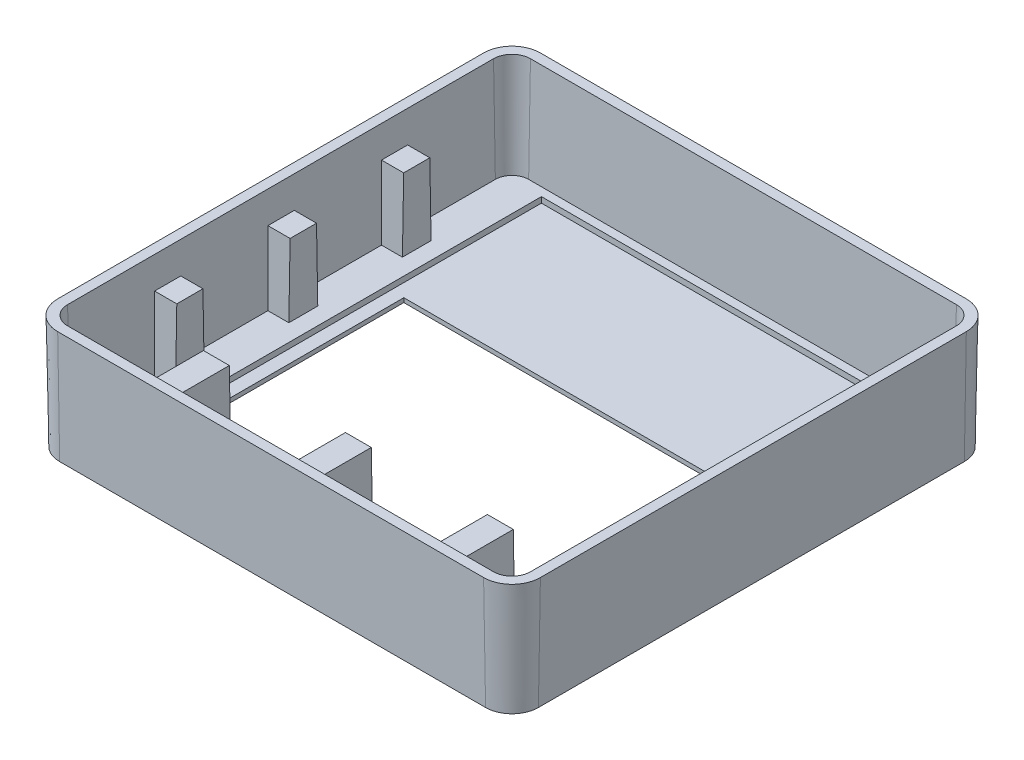
from build123d import *

# Parameters (mm, degrees)
BOSS_EXTRUDE1_DEPTH  = 4
BOSS_EXTRUDE1_DRAFT  = -1
SHELL1_T             = -0.35
SKETCH2_W            = 12.58
SKETCH2_H            = 6.98
CUT_EXTRUDE1_DEPTH   = 2
SKETCH3_W            = 13.5
SKETCH3_H            = 13.096235698
CUT_EXTRUDE2_DEPTH   = 0.2
BOSS_EXTRUDE3_REACH  = 20.425
BOSS_EXTRUDE4_REACH  = 20.425
LPATTERN2_COUNT      = 2
LPATTERN2_PITCH      = 4
MIRROR4_COPY_1_REACH = 20.425
MIRROR4_COPY_2_REACH = 20.425
LPATTERN3_COUNT      = 2
LPATTERN3_PITCH      = 4
MIRROR5_COPY_1_REACH = 20.425
MIRROR5_COPY_2_REACH = 20.425
BOSS_EXTRUDE5_REACH  = 18.785
LPATTERN4_COUNT      = 2
LPATTERN4_PITCH      = 5
MIRROR6_COPY_1_REACH = 18.785
MIRROR6_COPY_2_REACH = 18.785


with BuildPart() as part:
    # Sketch1 → Boss-Extrude1 (with draft: the straight prism first)
    with BuildSketch(Plane(origin=(0, 0, 0), x_dir=(1, 0, 0), z_dir=(0, 1, 0))):
        with BuildLine():
            Line((-7.5, -8.5), (7.5, -8.5))
            ThreePointArc((7.5, -8.5), (8.207106781, -8.207106781), (8.5, -7.5))
            Line((8.5, -7.5), (8.5, 7.5))
            ThreePointArc((8.5, 7.5), (8.207106781, 8.207106781), (7.5, 8.5))
            Line((7.5, 8.5), (-7.5, 8.5))
            ThreePointArc((-7.5, 8.5), (-8.207106781, 8.207106781), (-8.5, 7.5))
            Line((-8.5, 7.5), (-8.5, -7.5))
            ThreePointArc((-8.5, -7.5), (-8.207106781, -8.207106781), (-7.5, -8.5))
        make_face()
    extrude(amount=-BOSS_EXTRUDE1_DEPTH)
    # Boss-Extrude1: the draft: its side faces are tilted about the plane it starts from
    boss_extrude1_sides = [part.faces().sort_by_distance(p)[0] for p in [
        (0, -2, 8.5),
        (8.207106781, -2, 8.207106781),
        (8.5, -2, 0),
        (8.207106781, -2, -8.207106781),
        (0, -2, -8.5),
        (-8.207106781, -2, -8.207106781),
        (-8.5, -2, 0),
        (-8.207106781, -2, 8.207106781),
    ]]
    draft(boss_extrude1_sides, Plane(origin=(0, 0, 0), x_dir=(1, 0, 0), z_dir=(0, 1, 0)), BOSS_EXTRUDE1_DRAFT)

    # Shell1
    shell1_openings = [part.faces().sort_by_distance(p)[0] for p in [
        (0, 0, 0),
    ]]
    offset(amount=SHELL1_T, openings=shell1_openings, kind=Kind.INTERSECTION)

    # Sketch2 → Cut-Extrude1 (cut)
    with BuildSketch(Plane.XZ.offset(4)):
        with Locations((0, 1.01)):
            Rectangle(SKETCH2_W, SKETCH2_H)
    extrude(amount=-CUT_EXTRUDE1_DEPTH, mode=Mode.SUBTRACT)

    # Sketch3 → Cut-Extrude2 (cut)
    with BuildSketch(Plane(origin=(0, -3.65, 0), x_dir=(1, 0, 0), z_dir=(0, 1, 0))):
        with Locations((0, 1.238117849)):
            Rectangle(SKETCH3_W, SKETCH3_H)
    extrude(amount=-CUT_EXTRUDE2_DEPTH, mode=Mode.SUBTRACT)

    # Boss-Extrude3: up to this plane
    boss_extrude3_end = Plane(origin=(8.150053307, 0.006108342, 7.5), z_dir=(0.9998476951563913, -0.01745240643728355, 0))
    # Sketch11 → Boss-Extrude3 (add, up to the surface)
    with BuildSketch(Plane.ZY.offset(-7.35), mode=Mode.PRIVATE) as boss_extrude3_sk1:
        Polygon((-0.455489584, -1.1), (0.46508987, -1.1), (0.509600286, -3.65), (-0.5, -3.65), align=None)
    boss_extrude3_tool1 = split(extrude(boss_extrude3_sk1.sketch, amount=-BOSS_EXTRUDE3_REACH, mode=Mode.PRIVATE), bisect_by=boss_extrude3_end, keep=Keep.BOTH, mode=Mode.PRIVATE)
    boss_extrude3 = boss_extrude3_tool1.solids().sort_by_distance((7.35, -2.394601, 0.0048))[0]
    add(boss_extrude3)

    # Boss-Extrude4: up to this plane
    boss_extrude4_end = Plane(origin=(-8.150053307, 0.006108342, 7.5), z_dir=(-0.9998476951563913, -0.01745240643728355, 0))
    # Sketch13 → Boss-Extrude4 (add, up to the surface)
    with BuildSketch(Plane(origin=(-7.35, 0, 0), x_dir=(0, 0, -1), z_dir=(1, 0, 0)), mode=Mode.PRIVATE) as boss_extrude4_sk1:
        Polygon((-0.5, -3.65), (0.509600286, -3.65), (0.46508987, -1.1), (-0.455489584, -1.1), align=None)
    boss_extrude4_tool1 = split(extrude(boss_extrude4_sk1.sketch, amount=-BOSS_EXTRUDE4_REACH, mode=Mode.PRIVATE), bisect_by=boss_extrude4_end, keep=Keep.BOTH, mode=Mode.PRIVATE)
    boss_extrude4 = boss_extrude4_tool1.solids().sort_by_distance((-7.35, -2.394601, -0.0048))[0]
    add(boss_extrude4)

    # LPattern2: Boss-Extrude3 ×2
    with Locations(*[(0, 0, i * LPATTERN2_PITCH) for i in range(1, LPATTERN2_COUNT)]):
        add(boss_extrude3)

    # Mirror4 copy 1: up to this plane
    mirror4_copy_1_end = Plane(origin=(8.150053307, 0.006108342, 7.5), z_dir=(0.9998476951563913, -0.01745240643728355, 0))
    # Mirror4 copy 1 sketch → Mirror4 copy 1 (add, up to the surface)
    with BuildSketch(Plane(origin=(7.35, 0, -4), x_dir=(0, 0, -1), z_dir=(-1, 0, 0)), mode=Mode.PRIVATE) as mirror4_copy_1_sk1:
        Polygon((-0.455489584, 1.1), (0.46508987, 1.1), (0.509600286, 3.65), (-0.5, 3.65), align=None)
    mirror4_copy_1_tool1 = split(extrude(mirror4_copy_1_sk1.sketch, amount=-MIRROR4_COPY_1_REACH, mode=Mode.PRIVATE), bisect_by=mirror4_copy_1_end, keep=Keep.BOTH, mode=Mode.PRIVATE)
    add(mirror4_copy_1_tool1.solids().sort_by_distance((7.35, -2.394601, 0.0048))[0])

    # Mirror4 copy 2: up to this plane
    mirror4_copy_2_end = Plane(origin=(8.150053307, 0.006108342, 7.5), z_dir=(0.9998476951563913, -0.01745240643728355, 0))
    # Mirror4 copy 2 sketch → Mirror4 copy 2 (add, up to the surface)
    with BuildSketch(Plane(origin=(7.35, 0, 0), x_dir=(0, 0, -1), z_dir=(-1, 0, 0)), mode=Mode.PRIVATE) as mirror4_copy_2_sk1:
        Polygon((-0.455489584, 1.1), (0.46508987, 1.1), (0.509600286, 3.65), (-0.5, 3.65), align=None)
    mirror4_copy_2_tool1 = split(extrude(mirror4_copy_2_sk1.sketch, amount=-MIRROR4_COPY_2_REACH, mode=Mode.PRIVATE), bisect_by=mirror4_copy_2_end, keep=Keep.BOTH, mode=Mode.PRIVATE)
    add(mirror4_copy_2_tool1.solids().sort_by_distance((7.35, -2.394601, 0.0048))[0])

    # LPattern3: Boss-Extrude4 ×2
    with Locations(*[(0, 0, i * LPATTERN3_PITCH) for i in range(1, LPATTERN3_COUNT)]):
        add(boss_extrude4)

    # Mirror5 copy 1: up to this plane
    mirror5_copy_1_end = Plane(origin=(-8.150053307, 0.006108342, 7.5), z_dir=(-0.9998476951563913, -0.01745240643728355, 0))
    # Mirror5 copy 1 sketch → Mirror5 copy 1 (add, up to the surface)
    with BuildSketch(Plane(origin=(-7.35, 0, -4), x_dir=(0, 0, 1), z_dir=(1, 0, 0)), mode=Mode.PRIVATE) as mirror5_copy_1_sk1:
        Polygon((-0.5, 3.65), (0.509600286, 3.65), (0.46508987, 1.1), (-0.455489584, 1.1), align=None)
    mirror5_copy_1_tool1 = split(extrude(mirror5_copy_1_sk1.sketch, amount=-MIRROR5_COPY_1_REACH, mode=Mode.PRIVATE), bisect_by=mirror5_copy_1_end, keep=Keep.BOTH, mode=Mode.PRIVATE)
    add(mirror5_copy_1_tool1.solids().sort_by_distance((-7.35, -2.394601, -0.0048))[0])

    # Mirror5 copy 2: up to this plane
    mirror5_copy_2_end = Plane(origin=(-8.150053307, 0.006108342, 7.5), z_dir=(-0.9998476951563913, -0.01745240643728355, 0))
    # Mirror5 copy 2 sketch → Mirror5 copy 2 (add, up to the surface)
    with BuildSketch(Plane(origin=(-7.35, 0, 0), x_dir=(0, 0, 1), z_dir=(1, 0, 0)), mode=Mode.PRIVATE) as mirror5_copy_2_sk1:
        Polygon((-0.5, 3.65), (0.509600286, 3.65), (0.46508987, 1.1), (-0.455489584, 1.1), align=None)
    mirror5_copy_2_tool1 = split(extrude(mirror5_copy_2_sk1.sketch, amount=-MIRROR5_COPY_2_REACH, mode=Mode.PRIVATE), bisect_by=mirror5_copy_2_end, keep=Keep.BOTH, mode=Mode.PRIVATE)
    add(mirror5_copy_2_tool1.solids().sort_by_distance((-7.35, -2.394601, -0.0048))[0])

    # Boss-Extrude5: up to this plane
    boss_extrude5_end = Plane(origin=(-7.5, 0.006108342, 8.150053307), z_dir=(0, -0.017452406437283553, 0.9998476951563913))
    # Sketch16 → Boss-Extrude5 (add, up to the surface)
    with BuildSketch(Plane.XY.offset(5.41), mode=Mode.PRIVATE) as boss_extrude5_sk1:
        Polygon((-0.5, -3.65), (0.5, -3.65), (0.455489584, -1.1), (-0.455489584, -1.1), align=None)
    boss_extrude5_tool1 = split(extrude(boss_extrude5_sk1.sketch, amount=BOSS_EXTRUDE5_REACH, mode=Mode.PRIVATE), bisect_by=boss_extrude5_end, keep=Keep.BOTH, mode=Mode.PRIVATE)
    boss_extrude5 = boss_extrude5_tool1.solids().sort_by_distance((0, -2.394798, 5.41))[0]
    add(boss_extrude5)

    # LPattern4: Boss-Extrude5 ×2
    with Locations(*[(i * LPATTERN4_PITCH, 0, 0) for i in range(1, LPATTERN4_COUNT)]):
        add(boss_extrude5)

    # Mirror6 copy 1: up to this plane
    mirror6_copy_1_end = Plane(origin=(-7.5, 0.006108342, 8.150053307), z_dir=(0, -0.017452406437283553, 0.9998476951563913))
    # Mirror6 copy 1 sketch → Mirror6 copy 1 (add, up to the surface)
    with BuildSketch(Plane(origin=(-5, 0, 5.41), x_dir=(-1, 0, 0), z_dir=(0, 0, 1)), mode=Mode.PRIVATE) as mirror6_copy_1_sk1:
        Polygon((-0.5, 3.65), (0.5, 3.65), (0.455489584, 1.1), (-0.455489584, 1.1), align=None)
    mirror6_copy_1_tool1 = split(extrude(mirror6_copy_1_sk1.sketch, amount=MIRROR6_COPY_1_REACH, mode=Mode.PRIVATE), bisect_by=mirror6_copy_1_end, keep=Keep.BOTH, mode=Mode.PRIVATE)
    add(mirror6_copy_1_tool1.solids().sort_by_distance((0, -2.394798, 5.41))[0])

    # Mirror6 copy 2: up to this plane
    mirror6_copy_2_end = Plane(origin=(-7.5, 0.006108342, 8.150053307), z_dir=(0, -0.017452406437283553, 0.9998476951563913))
    # Mirror6 copy 2 sketch → Mirror6 copy 2 (add, up to the surface)
    with BuildSketch(Plane(origin=(0, 0, 5.41), x_dir=(-1, 0, 0), z_dir=(0, 0, 1)), mode=Mode.PRIVATE) as mirror6_copy_2_sk1:
        Polygon((-0.5, 3.65), (0.5, 3.65), (0.455489584, 1.1), (-0.455489584, 1.1), align=None)
    mirror6_copy_2_tool1 = split(extrude(mirror6_copy_2_sk1.sketch, amount=MIRROR6_COPY_2_REACH, mode=Mode.PRIVATE), bisect_by=mirror6_copy_2_end, keep=Keep.BOTH, mode=Mode.PRIVATE)
    add(mirror6_copy_2_tool1.solids().sort_by_distance((0, -2.394798, 5.41))[0])


solid = part.part
